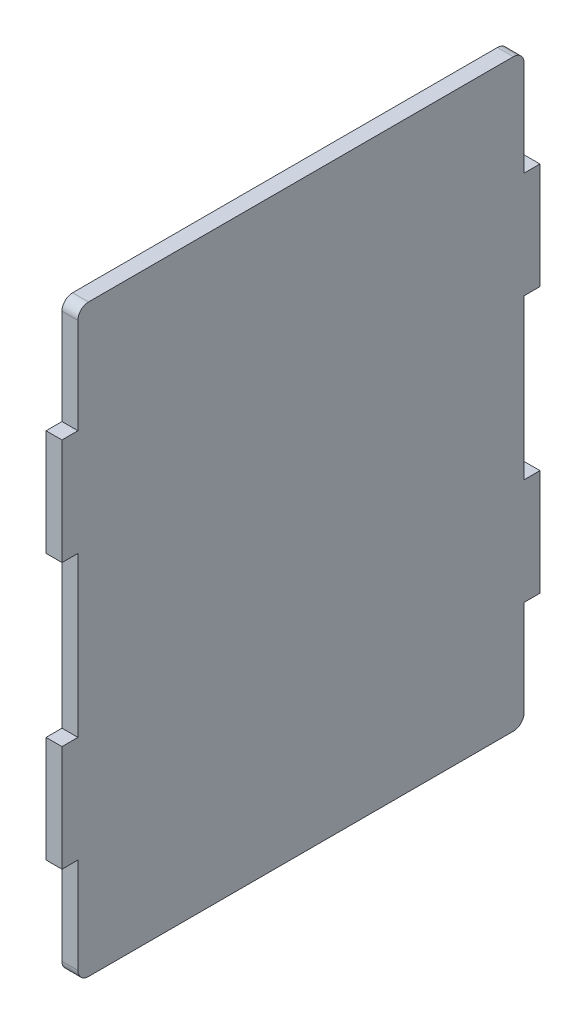
from build123d import *

# Parameters (mm, degrees)
SKETCH1_W           = 3
SKETCH1_H           = 110
EXTRUDE_THIN1_DEPTH = 90
CAVITY1_START       = 14.397705985
CAVITY1_OUTLINE_W   = 3
CAVITY1_OUTLINE_H   = 3
CAVITY1_DEPTH       = 30
CAVITY1_START_2     = -25.602294015
CAVITY1_2_OUTLINE_W = 3
CAVITY1_2_OUTLINE_H = 3
CAVITY1_2_DEPTH     = 20
CAVITY1_START_3     = 64.397705985
CAVITY1_3_OUTLINE_W = 3
CAVITY1_3_OUTLINE_H = 3
CAVITY1_3_DEPTH     = 20
FILLET1_R           = 2


# Read off the part's stored shape, not the designer's step: Cavity1
with BuildPart() as part:
    # Sketch1 → Extrude-Thin1 (new body)
    with BuildSketch(Plane.XY.offset(1.5)):
        with Locations((-5.414893617, 29.397705985)):
            Rectangle(SKETCH1_W, SKETCH1_H)
    extrude(amount=-EXTRUDE_THIN1_DEPTH)

    # Cavity1 outline → Cavity1 (cut)
    with BuildSketch(Plane(origin=(0, 0, 0), x_dir=(1, 0, 0), z_dir=(0, 1, 0)).offset(CAVITY1_START)):
        with Locations((-5.414893617, 87)):
            Rectangle(CAVITY1_OUTLINE_W, CAVITY1_OUTLINE_H)
        with Locations((-5.414893617, 0)):
            Rectangle(CAVITY1_OUTLINE_W, CAVITY1_OUTLINE_H)
    extrude(amount=CAVITY1_DEPTH, mode=Mode.SUBTRACT)

    # Cavity1 2 outline → Cavity1 2 (cut)
    with BuildSketch(Plane(origin=(0, 0, 0), x_dir=(1, 0, 0), z_dir=(0, 1, 0)).offset(CAVITY1_START_2)):
        with Locations((-5.414893617, 87)):
            Rectangle(CAVITY1_2_OUTLINE_W, CAVITY1_2_OUTLINE_H)
        with Locations((-5.414893617, 0)):
            Rectangle(CAVITY1_2_OUTLINE_W, CAVITY1_2_OUTLINE_H)
    extrude(amount=CAVITY1_2_DEPTH, mode=Mode.SUBTRACT)

    # Cavity1 3 outline → Cavity1 3 (cut)
    with BuildSketch(Plane(origin=(0, 0, 0), x_dir=(1, 0, 0), z_dir=(0, 1, 0)).offset(CAVITY1_START_3)):
        with Locations((-5.414893617, 87)):
            Rectangle(CAVITY1_3_OUTLINE_W, CAVITY1_3_OUTLINE_H)
        with Locations((-5.414893617, 0)):
            Rectangle(CAVITY1_3_OUTLINE_W, CAVITY1_3_OUTLINE_H)
    extrude(amount=CAVITY1_3_DEPTH, mode=Mode.SUBTRACT)

    # Fillet1
    fillet1_edges = [part.edges().sort_by_distance(p)[0] for p in [
        (-5.414893617, -25.602294015, -85.5),
        (-5.414893617, 84.397705985, -85.5),
        (-5.414893617, -25.602294015, -1.5),
        (-5.414893617, 84.397705985, -1.5),
    ]]
    fillet(fillet1_edges, radius=FILLET1_R)


solid = part.part
